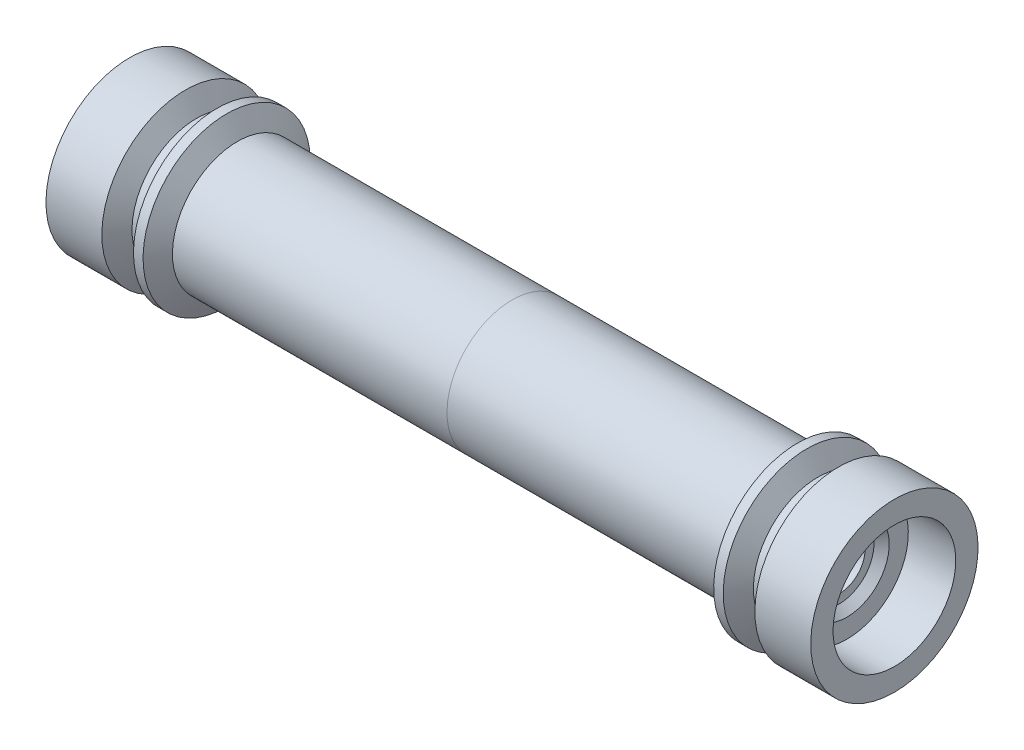
from build123d import *

# Parameters (mm, degrees)
CHAMFER1_SIZE = 0.508


with BuildPart() as part:
    # Sketch2 → Revolve1 (revolve)
    with BuildSketch(Plane.XY):
        Polygon((-21.688234842, 5.55625), (-25.4, 5.55625), (-25.4, 4.075), (-22.25, 4.075), (-22.25, 2.805), (-21.742, 2.297), (-21.742, 1.7145), (-15.575, 1.7145), (-15.575, 0), (-14.1, 0), (-12.5, 1.6), (0, 1.6), (0, 4.318), (-18.236861187, 4.318), (-18.951765158, 5.55625), (-19.586765158, 5.55625), (-20.32, 4.28625), (-20.955, 4.28625), align=None)
    revolve(axis=Axis((-25.4, 0, 0), (1, 0, 0)))


with BuildPart() as body_2:
    # Mirror1: mirrored copy
    add(part.part.mirror(Plane(origin=(0, 0, 0), x_dir=(0, 0, 1), z_dir=(1, 0, 0))))


with BuildPart() as part_1:
    add(part.part)

    # Chamfer1
    chamfer1_edges = [part_1.edges().sort_by_distance(p)[0] for p in [
        (-25.4, -4.075, 0),
    ]]
    chamfer(chamfer1_edges, length=CHAMFER1_SIZE)


solid = Compound([body_2.part, part_1.part])
